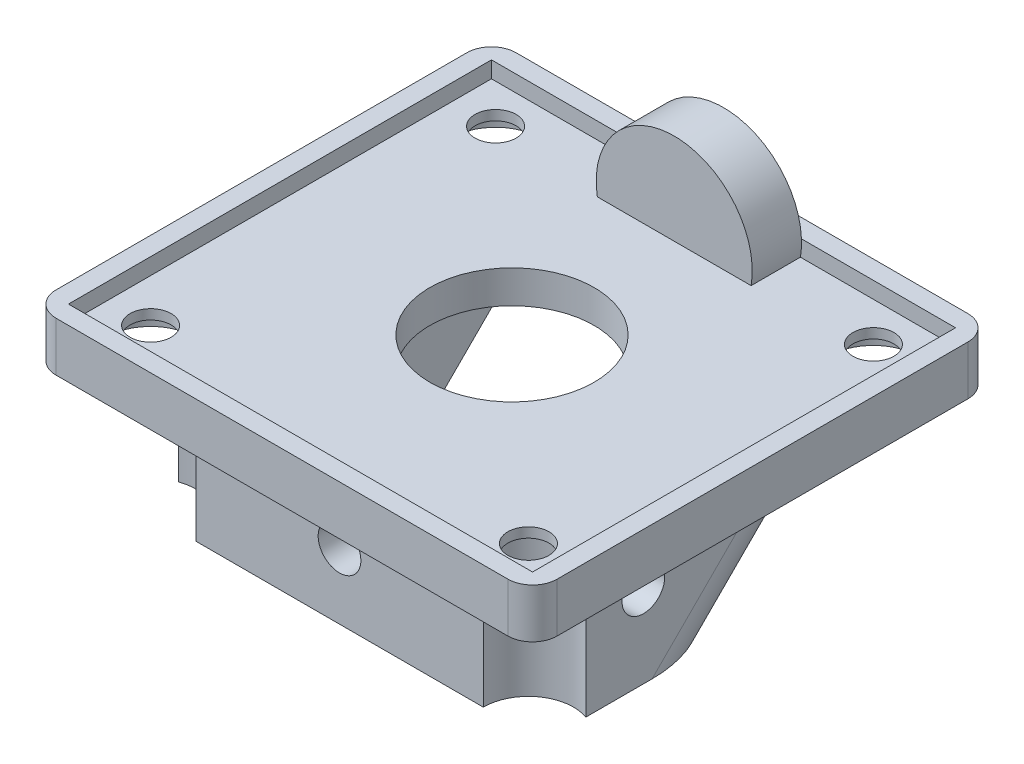
from build123d import *

# Parameters (mm, degrees)
SKETCH_1_W           = 30.5
SKETCH_1_H           = 28
EXTRUDE_1_DEPTH      = 1.6
SKETCH_2_W           = 28.25
SKETCH_2_H           = 25.75
CUT_EXTRUDE_1_DEPTH  = 1
EXTRUDE_2_DEPTH      = 3
CUT_EXTRUDE_2_REACH  = 43.774
SKETCH_5_R           = 1.25
CUT_EXTRUDE_3_REACH  = 43.774
SKETCH_6_R           = 5
SKETCH_7_W           = 30.5
SKETCH_7_H           = 28
SKETCH_7_R           = 2.75
SKETCH_7_R_2         = 5
EXTRUDE_3_DEPTH      = 1.4
SKETCH_8_W           = 5
SKETCH_8_H           = 14
EXTRUDE_4_DEPTH      = 10
CUT_EXTRUDE_4_DEPTH  = 41.969287277
SKETCH_10_W          = 24.8
SKETCH_10_H          = 10
EXTRUDE_5_DEPTH      = 3.5
SKETCH_11_R          = 2.75
CUT_EXTRUDE_5_DEPTH  = 43.944266206
SKETCH_12_R          = 1.3
CUT_EXTRUDE_6_DEPTH  = 41.969287277
CUT_EXTRUDE_7_REACH  = 42.749
SKETCH_13_R          = 1.3
CUT_EXTRUDE_8_REACH  = 42.969
SKETCH_14_W          = 12
SKETCH_14_H          = 2
SKETCH_15_W          = 14.8
SKETCH_15_H          = 8
SKETCH_15_R          = 1.3
EXTRUDE_6_DEPTH      = 2
FILLET_1_R           = 3.8
FILLET_2_R           = 1.5
FILLET_3_R           = 3
CUT_EXTRUDE_START    = -3
CUT_EXTRUDE_9_DEPTH  = 3
CUT_EXTRUDE_10_DEPTH = 3
FILLET_4_R           = 1


with BuildPart() as part:
    # 草图1 → 凸台-拉伸1 (new body)
    with BuildSketch(Plane(origin=(0, 0, 0), x_dir=(1, 0, 0), z_dir=(0, 1, 0))):
        with Locations((15.25, 14)):
            Rectangle(SKETCH_1_W, SKETCH_1_H)
    extrude(amount=EXTRUDE_1_DEPTH)

    # 草图2 → 切除-拉伸1 (cut)
    with BuildSketch(Plane(origin=(0, 1.6, 0), x_dir=(1, 0, 0), z_dir=(0, 1, 0))):
        with Locations((15.25, 14)):
            Rectangle(SKETCH_2_W, SKETCH_2_H)
    extrude(amount=-CUT_EXTRUDE_1_DEPTH, mode=Mode.SUBTRACT)

    # 草图3 → 凸台-拉伸2 (add)
    with BuildSketch(Plane(origin=(57.75, 0, -26.875), x_dir=(1, 0, 0), z_dir=(0, 0, 1))):
        with BuildLine():
            Line((-47.182146943, 0.6), (-37.817853057, 0.6))
            ThreePointArc((-37.817853057, 0.6), (-42.5, 6.15), (-47.182146943, 0.6))
        make_face()
    extrude(amount=EXTRUDE_2_DEPTH)

    # 草图5 → 切除-拉伸2 (cut, up to next)
    with BuildSketch(Plane(origin=(0, 0.6, 0), x_dir=(1, 0, 0), z_dir=(0, 1, 0)), mode=Mode.PRIVATE) as cut_extrude_2_sk1:
        with Locations(Location((3.75, 24.5, 0), (0, 0, 270))):
            Circle(SKETCH_5_R)
    cut_extrude_2_tool1 = extrude(cut_extrude_2_sk1.sketch, amount=-CUT_EXTRUDE_2_REACH, mode=Mode.PRIVATE) & part.part
    # 草图5 → 切除-拉伸2 (cut, up to next)
    with BuildSketch(Plane(origin=(0, 0.6, 0), x_dir=(1, 0, 0), z_dir=(0, 1, 0)), mode=Mode.PRIVATE) as cut_extrude_2_sk2:
        with Locations(Location((26.75, 24.5, 0), (0, 0, 270))):
            Circle(SKETCH_5_R)
    cut_extrude_2_tool2 = extrude(cut_extrude_2_sk2.sketch, amount=-CUT_EXTRUDE_2_REACH, mode=Mode.PRIVATE) & part.part
    # 草图5 → 切除-拉伸2 (cut, up to next)
    with BuildSketch(Plane(origin=(0, 0.6, 0), x_dir=(1, 0, 0), z_dir=(0, 1, 0)), mode=Mode.PRIVATE) as cut_extrude_2_sk3:
        with Locations(Location((3.75, 3.5, 0), (0, 0, 270))):
            Circle(SKETCH_5_R)
    cut_extrude_2_tool3 = extrude(cut_extrude_2_sk3.sketch, amount=-CUT_EXTRUDE_2_REACH, mode=Mode.PRIVATE) & part.part
    # 草图5 → 切除-拉伸2 (cut, up to next)
    with BuildSketch(Plane(origin=(0, 0.6, 0), x_dir=(1, 0, 0), z_dir=(0, 1, 0)), mode=Mode.PRIVATE) as cut_extrude_2_sk4:
        with Locations(Location((26.75, 3.5, 0), (0, 0, 270))):
            Circle(SKETCH_5_R)
    cut_extrude_2_tool4 = extrude(cut_extrude_2_sk4.sketch, amount=-CUT_EXTRUDE_2_REACH, mode=Mode.PRIVATE) & part.part
    add(cut_extrude_2_tool1.solids().sort_by_distance((3.75, 0.6, -24.5))[0], mode=Mode.SUBTRACT)
    add(cut_extrude_2_tool2.solids().sort_by_distance((26.75, 0.6, -24.5))[0], mode=Mode.SUBTRACT)
    add(cut_extrude_2_tool3.solids().sort_by_distance((3.75, 0.6, -3.5))[0], mode=Mode.SUBTRACT)
    add(cut_extrude_2_tool4.solids().sort_by_distance((26.75, 0.6, -3.5))[0], mode=Mode.SUBTRACT)

    # 草图6 → 切除-拉伸3 (cut, up to next)
    with BuildSketch(Plane(origin=(0, 0.6, 0), x_dir=(1, 0, 0), z_dir=(0, 1, 0)), mode=Mode.PRIVATE) as cut_extrude_3_sk1:
        with Locations(Location((15.25, 14, 0), (0, 0, 270))):
            Circle(SKETCH_6_R)
    cut_extrude_3_tool1 = extrude(cut_extrude_3_sk1.sketch, amount=-CUT_EXTRUDE_3_REACH, mode=Mode.PRIVATE) & part.part
    add(cut_extrude_3_tool1.solids().sort_by_distance((15.25, 0.6, -14))[0], mode=Mode.SUBTRACT)

    # 草图7 → 凸台-拉伸3 (add)
    with BuildSketch(Plane.XZ):
        with Locations((15.25, -14)):
            Rectangle(SKETCH_7_W, SKETCH_7_H)
        with Locations(Location((3.75, -3.5, 0), (0, 0, 270))):
            Circle(SKETCH_7_R, mode=Mode.SUBTRACT)
        with Locations(Location((26.75, -3.5, 0), (0, 0, 270))):
            Circle(SKETCH_7_R, mode=Mode.SUBTRACT)
        with Locations(Location((3.75, -24.5, 0), (0, 0, 270))):
            Circle(SKETCH_7_R, mode=Mode.SUBTRACT)
        with Locations(Location((26.75, -24.5, 0), (0, 0, 270))):
            Circle(SKETCH_7_R, mode=Mode.SUBTRACT)
        with Locations(Location((15.25, -14, 0), (0, 0, 90))):
            Circle(SKETCH_7_R_2, mode=Mode.SUBTRACT)
    extrude(amount=EXTRUDE_3_DEPTH)

    # 草图8 → 凸台-拉伸4 (add)
    with BuildSketch(Plane.XZ.offset(1.4)):
        with Locations((25.15, -14)):
            Rectangle(SKETCH_8_W, SKETCH_8_H)
        with Locations((5.35, -14)):
            Rectangle(SKETCH_8_W, SKETCH_8_H)
    extrude(amount=EXTRUDE_4_DEPTH)

    # 草图9 → 切除-拉伸4 (cut, through all)
    with BuildSketch(Plane.ZY.offset(-2.85)):
        Polygon((-21, -3.9), (-13.5, -11.4), (-21, -11.4), align=None)
    extrude(amount=-CUT_EXTRUDE_4_DEPTH, mode=Mode.SUBTRACT)

    # 草图10 → 凸台-拉伸5 (add)
    with BuildSketch(Plane.XY.offset(-7)):
        with Locations((15.25, -6.4)):
            Rectangle(SKETCH_10_W, SKETCH_10_H)
    extrude(amount=EXTRUDE_5_DEPTH)

    # 草图11 → 切除-拉伸5 (cut, through all)
    with BuildSketch(Plane.XZ):
        with Locations(Location((26.75, -3.5, 0), (0, 0, 180))):
            Circle(SKETCH_11_R)
        with Locations((3.75, -3.5)):
            Circle(SKETCH_11_R)
    extrude(amount=CUT_EXTRUDE_5_DEPTH, mode=Mode.SUBTRACT)

    # 草图12 → 切除-拉伸6 (cut, through all)
    with BuildSketch(Plane.ZY.offset(-2.85)):
        with Locations((-9.598557292, -4.4)):
            Circle(SKETCH_12_R)
    extrude(amount=-CUT_EXTRUDE_6_DEPTH, mode=Mode.SUBTRACT)

    # 草图13 → 切除-拉伸7 (cut, up to next)
    with BuildSketch(Plane.XY.offset(-3.5), mode=Mode.PRIVATE) as cut_extrude_7_sk1:
        with Locations((15.25, -5.4)):
            Circle(SKETCH_13_R)
    cut_extrude_7_tool1 = extrude(cut_extrude_7_sk1.sketch, amount=-CUT_EXTRUDE_7_REACH, mode=Mode.PRIVATE) & part.part
    add(cut_extrude_7_tool1.solids().sort_by_distance((15.25, -5.4, -3.5))[0], mode=Mode.SUBTRACT)

    # 草图14 → 切除-拉伸8 (cut, up to next)
    with BuildSketch(Plane(origin=(27.65, 0, 0), x_dir=(0, 0, -1), z_dir=(1, 0, 0)), mode=Mode.PRIVATE) as cut_extrude_8_sk1:
        with Locations((9.5, -10.4)):
            Rectangle(SKETCH_14_W, SKETCH_14_H)
    cut_extrude_8_tool1 = extrude(cut_extrude_8_sk1.sketch, amount=-CUT_EXTRUDE_8_REACH, mode=Mode.PRIVATE) & part.part
    add(cut_extrude_8_tool1.solids().sort_by_distance((27.65, -10.4, -9.5))[0], mode=Mode.SUBTRACT)

    # 草图15 → 凸台-拉伸6 (add)
    with BuildSketch(Plane(origin=(0, 0, -7), x_dir=(-1, 0, 0), z_dir=(0, 0, -1))):
        with Locations((-15.25, -5.4)):
            Rectangle(SKETCH_15_W, SKETCH_15_H)
        with Locations(Location((-15.25, -5.4, 0), (0, 0, 180))):
            Circle(SKETCH_15_R, mode=Mode.SUBTRACT)
    extrude(amount=EXTRUDE_6_DEPTH)

    # 圆角1
    fillet_1_edges = [part.edges().sort_by_distance(p)[0] for p in [
        (27.65, -6.65, -18.25),
        (2.85, -6.65, -18.25),
    ]]
    fillet(fillet_1_edges, radius=FILLET_1_R)

    # 圆角2
    fillet_2_edges = [part.edges().sort_by_distance(p)[0] for p in [
        (0, 0.1, -28),
        (30.5, 0.1, -28),
        (30.5, 0.1, 0),
        (0, 0.1, 0),
    ]]
    fillet(fillet_2_edges, radius=FILLET_2_R)

    # 圆角3
    # the kernel refuses this fillet: 3 mm, written as the material it adds along each edge
    with BuildSketch(Plane(origin=(22.65, 6.1, -9), x_dir=(0, 0, -1), z_dir=(0, -1, 0))) as fillet_3_piece_1_section:
        with BuildLine():
            CenterArc((FILLET_3_R, -FILLET_3_R), FILLET_3_R, 90, 90)
            Line((0, -FILLET_3_R), (0, 0))
            Line((0, 0), (FILLET_3_R, 0))
        make_face()
    fillet_3_piece_1 = extrude(amount=16.845994295, mode=Mode.PRIVATE)
    fillet_3_piece_1 = split(fillet_3_piece_1, bisect_by=Plane(origin=(22.65, -9.4, -9), z_dir=(0, 1, 0)), keep=Keep.TOP, mode=Mode.PRIVATE)
    fillet_3_piece_1 = fillet_3_piece_1 - Plane(origin=(22.65, -4.4, -9.598557292), x_dir=(0, 0, 1), z_dir=(-1, 0, 0)) * Cylinder(1.3, 46, mode=Mode.PRIVATE)
    fillet_3_piece_1 = split(fillet_3_piece_1, bisect_by=Plane(origin=(22.65, 0.6, -9), z_dir=(0, -1, 0)), keep=Keep.TOP, mode=Mode.PRIVATE)
    add(fillet_3_piece_1)
    with BuildSketch(Plane(origin=(7.85, -10.745994295, -9), x_dir=(1, 0, 0), z_dir=(0, 1, 0))) as fillet_3_piece_2_section:
        with BuildLine():
            CenterArc((FILLET_3_R, FILLET_3_R), FILLET_3_R, 180, 90)
            Line((0, FILLET_3_R), (0, 0))
            Line((0, 0), (FILLET_3_R, 0))
        make_face()
    fillet_3_piece_2 = extrude(amount=16.845994295, mode=Mode.PRIVATE)
    fillet_3_piece_2 = split(fillet_3_piece_2, bisect_by=Plane(origin=(7.85, -9.4, -9), z_dir=(0, 1, 0)), keep=Keep.TOP, mode=Mode.PRIVATE)
    fillet_3_piece_2 = fillet_3_piece_2 - Plane(origin=(7.85, -4.4, -9.598557292), x_dir=(0, 0, 1), z_dir=(-1, 0, 0)) * Cylinder(1.3, 46, mode=Mode.PRIVATE)
    fillet_3_piece_2 = split(fillet_3_piece_2, bisect_by=Plane(origin=(7.85, 0.6, -9), z_dir=(0, -1, 0)), keep=Keep.TOP, mode=Mode.PRIVATE)
    add(fillet_3_piece_2)

    # 草图16 → 切除-拉伸9 (cut)
    with BuildSketch(Plane(origin=(22.65, 0, 0), x_dir=(0, 0, -1), z_dir=(1, 0, 0)).offset(CUT_EXTRUDE_START)):
        with BuildLine():
            Line((9, -5.554005705), (9, -3.245994295))
            ThreePointArc((9, -3.245994295), (8.298557292, -4.4), (9, -5.554005705))
        make_face()
    extrude(amount=CUT_EXTRUDE_9_DEPTH, mode=Mode.SUBTRACT)

    # 草图17 → 切除-拉伸10 (cut)
    with BuildSketch(Plane.ZY.offset(-7.85)):
        with BuildLine():
            Line((-9, -3.245994295), (-9, -5.554005705))
            ThreePointArc((-9, -5.554005705), (-8.298557292, -4.4), (-9, -3.245994295))
        make_face()
    extrude(amount=-CUT_EXTRUDE_10_DEPTH, mode=Mode.SUBTRACT)

    # 圆角4
    # the kernel refuses this fillet: 1 mm, written as the material it adds along each edge
    with BuildSketch(Plane(origin=(10.85, -4.4, -9.598557292), x_dir=(0, -0.12437985627786666, -0.9922346755441966), z_dir=(0, 0.9922346755441966, -0.12437985627786666))) as fillet_4_piece_1_section:
        with BuildLine():
            CenterArc((1.3 - FILLET_4_R, FILLET_4_R), FILLET_4_R, 270, 90)
            Line((1.3 - FILLET_4_R, 0), (1.3, 0))
            Line((1.3, 0), (1.3, FILLET_4_R))
        make_face()
    fillet_4_piece_1 = revolve(axis=Axis((10.85, -4.4, -9.598557292), (-1, 0, 0)), revolution_arc=345.710110631, mode=Mode.PRIVATE)
    fillet_4_piece_1 = split(fillet_4_piece_1, bisect_by=Plane(origin=(10.85, -4.4, -9), z_dir=(0, 0, 1)), keep=Keep.TOP, mode=Mode.PRIVATE)
    add(fillet_4_piece_1)
    with BuildSketch(Plane(origin=(19.65, -4.4, -9.598557292), x_dir=(0, 0.12437985627786262, -0.9922346755441972), z_dir=(0, -0.9922346755441972, -0.12437985627786262))) as fillet_4_piece_2_section:
        with BuildLine():
            CenterArc((1.3 - FILLET_4_R, FILLET_4_R), FILLET_4_R, 270, 90)
            Line((1.3, FILLET_4_R), (1.3, 0))
            Line((1.3, 0), (1.3 - FILLET_4_R, 0))
        make_face()
    fillet_4_piece_2 = revolve(axis=Axis((19.65, -4.4, -9.598557292), (1, 0, 0)), revolution_arc=345.710110631, mode=Mode.PRIVATE)
    fillet_4_piece_2 = split(fillet_4_piece_2, bisect_by=Plane(origin=(19.65, -4.4, -9), z_dir=(0, 0, 1)), keep=Keep.TOP, mode=Mode.PRIVATE)
    add(fillet_4_piece_2)


solid = part.part
